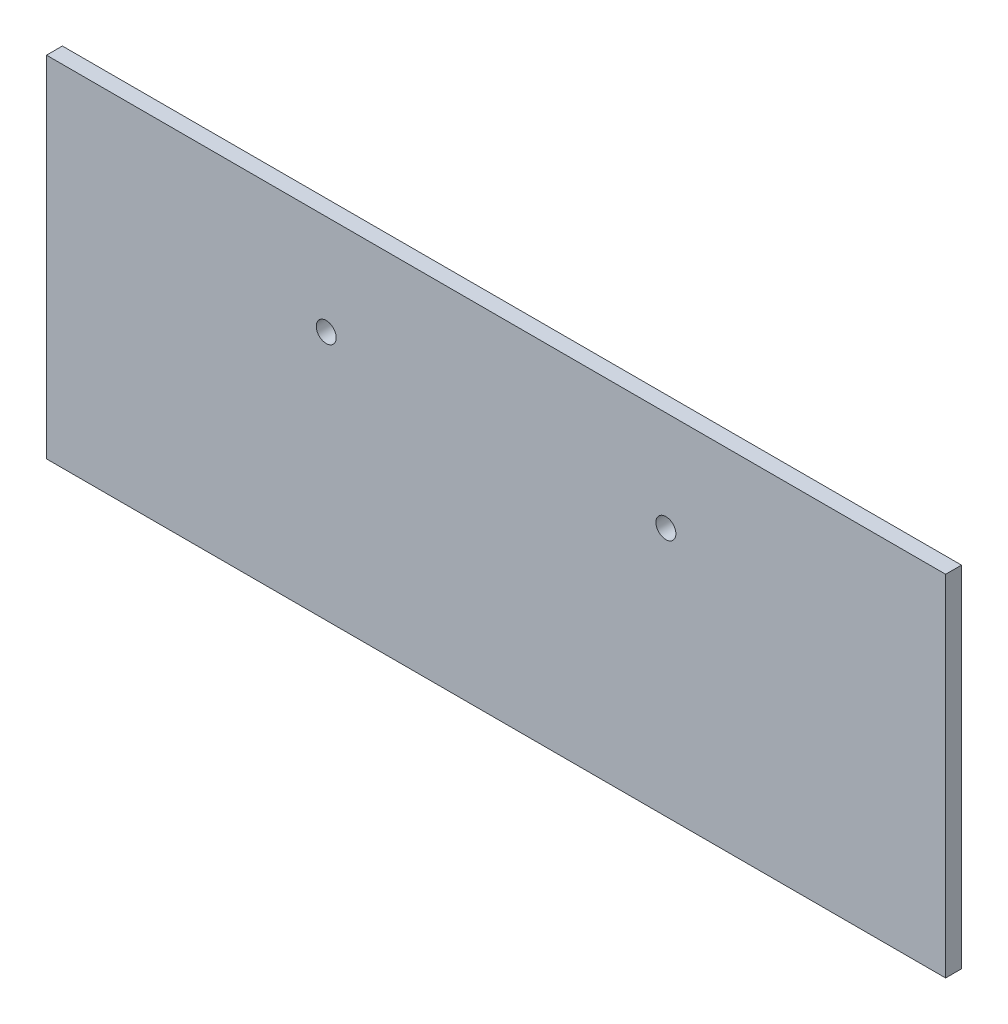
from build123d import *

# Parameters (mm, degrees)
SKETCH1_W           = 180
SKETCH1_H           = 70
SKETCH1_R           = 2
BOSS_EXTRUDE1_DEPTH = 3.175


with BuildPart() as part:
    # Sketch1 → Boss-Extrude1 (new body)
    with BuildSketch(Plane.XY):
        with Locations((90, 35)):
            Rectangle(SKETCH1_W, SKETCH1_H)
        with Locations((56, 50)):
            Circle(SKETCH1_R, mode=Mode.SUBTRACT)
        with Locations((124, 50)):
            Circle(SKETCH1_R, mode=Mode.SUBTRACT)
    extrude(amount=BOSS_EXTRUDE1_DEPTH)


solid = part.part
